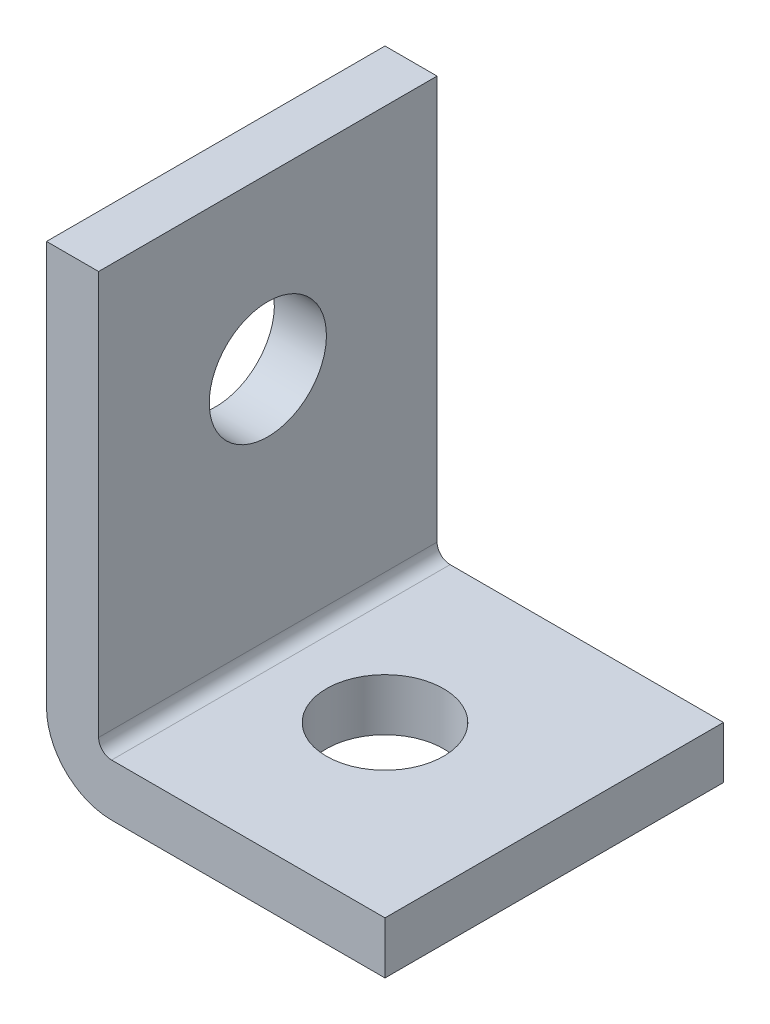
from build123d import *

# Parameters (mm, degrees)
EXTRUDE_THIN1_DEPTH = 20.6375
SKETCH2_R           = 7.14375
CUT_EXTRUDE1_DEPTH  = 69.63069307
SKETCH3_R           = 7.14375
CUT_EXTRUDE2_DEPTH  = 71.084124673


with BuildPart() as part:
    # Sketch1 → Extrude-Thin1 (new, symmetric)
    with BuildSketch(Plane.XY):
        with BuildLine():
            Line((0, 57.15), (0, 7.9375))
            ThreePointArc((0, 7.9375), (2.324839924, 2.324839924), (7.9375, 0))
            Line((7.9375, 0), (41.275, 0))
            Line((41.275, 0), (41.275, 6.35))
            Line((41.275, 6.35), (7.9375, 6.35))
            ThreePointArc((7.9375, 6.35), (6.814967985, 6.814967985), (6.35, 7.9375))
            Line((6.35, 7.9375), (6.35, 57.15))
            Line((6.35, 57.15), (0, 57.15))
        make_face()
    extrude(amount=EXTRUDE_THIN1_DEPTH, both=True)

    # Sketch2 → Cut-Extrude1 (cut, through all)
    with BuildSketch(Plane(origin=(0, 6.35, 0), x_dir=(1, 0, 0), z_dir=(0, 1, 0))):
        with Locations((20.6375, 0)):
            Circle(SKETCH2_R)
    extrude(amount=-CUT_EXTRUDE1_DEPTH, mode=Mode.SUBTRACT)

    # Sketch3 → Cut-Extrude2 (cut, through all)
    with BuildSketch(Plane(origin=(6.35, 0, 0), x_dir=(0, 0, -1), z_dir=(1, 0, 0))):
        with Locations((0, 36.5125)):
            Circle(SKETCH3_R)
    extrude(amount=-CUT_EXTRUDE2_DEPTH, mode=Mode.SUBTRACT)


solid = part.part
